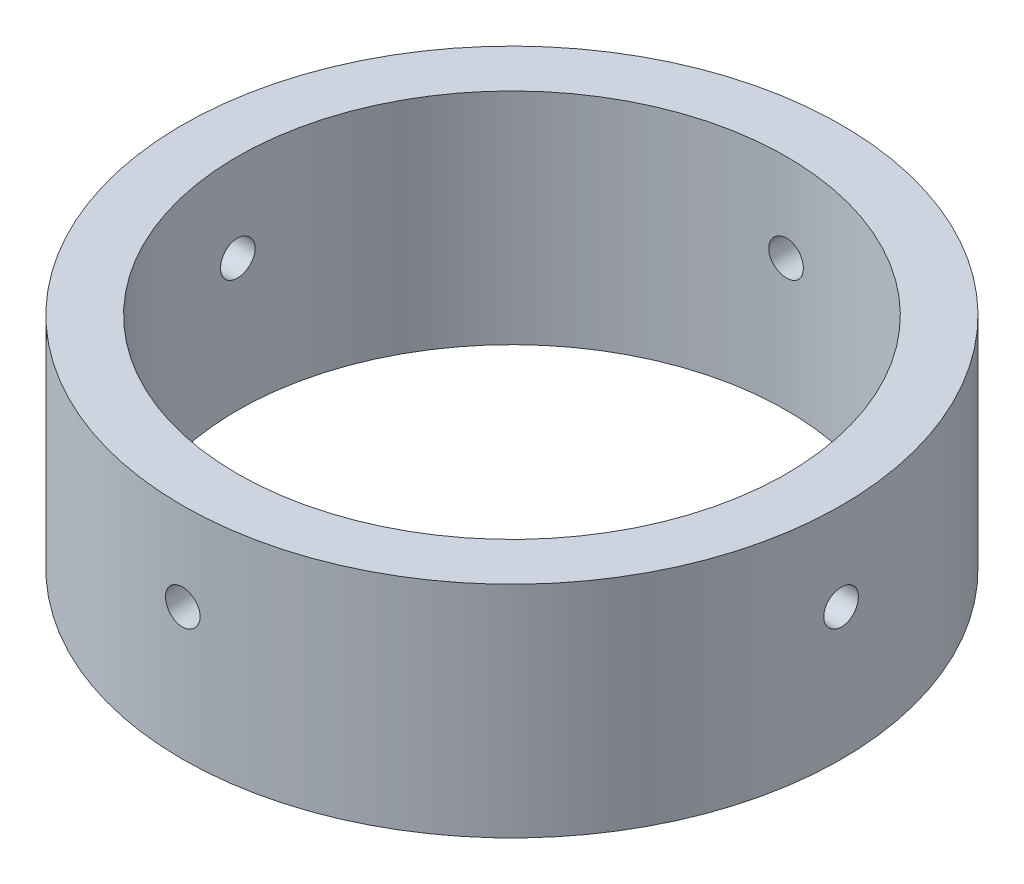
from build123d import *

# Parameters (mm, degrees)
SKETCH1_R               = 38.1
SKETCH1_R_2             = 31.75
BOSS_EXTRUDE1_DEPTH     = 25.4
CUT_EXTRUDE1_START      = -10
SKETCH2_R               = 2
CUT_EXTRUDE1_DEPTH      = 99.9
CIRPATTERN1_START       = 31.686945161
CIRPATTERN1_OUTLINE_R   = 2
CIRPATTERN1_DEPTH       = 6.413054905
CIRPATTERN1_START_2     = -38.100000066
CIRPATTERN1_2_OUTLINE_R = 2
CIRPATTERN1_2_DEPTH     = 76.200000132


# Read off the part's stored shape, not the designer's step: CirPattern1
with BuildPart() as part:
    # Sketch1 → Boss-Extrude1 (new body)
    with BuildSketch(Plane(origin=(0, 0, 0), x_dir=(1, 0, 0), z_dir=(0, 1, 0))):
        with Locations(Location((0, 0, 0), (0, 0, 270))):
            Circle(SKETCH1_R)
        with Locations(Location((0, 0, 0), (0, 0, 270))):
            Circle(SKETCH1_R_2, mode=Mode.SUBTRACT)
    extrude(amount=BOSS_EXTRUDE1_DEPTH)

    # Sketch2 → Cut-Extrude1 (cut)
    with BuildSketch(Plane.ZY.offset(38.1).offset(CUT_EXTRUDE1_START)):
        with Locations(Location((0, 15.24, 0), (0, 0, 180))):
            Circle(SKETCH2_R)
    extrude(amount=CUT_EXTRUDE1_DEPTH, mode=Mode.SUBTRACT)

    # CirPattern1 outline → CirPattern1 (cut)
    with BuildSketch(Plane.YZ.offset(CIRPATTERN1_START)):
        with Locations((15.24, 0)):
            Circle(CIRPATTERN1_OUTLINE_R)
    extrude(amount=CIRPATTERN1_DEPTH, mode=Mode.SUBTRACT)

    # CirPattern1 2 outline → CirPattern1 2 (cut)
    with BuildSketch(Plane.XY.offset(CIRPATTERN1_START_2)):
        with Locations((0, 15.24)):
            Circle(CIRPATTERN1_2_OUTLINE_R)
    extrude(amount=CIRPATTERN1_2_DEPTH, mode=Mode.SUBTRACT)


solid = part.part
